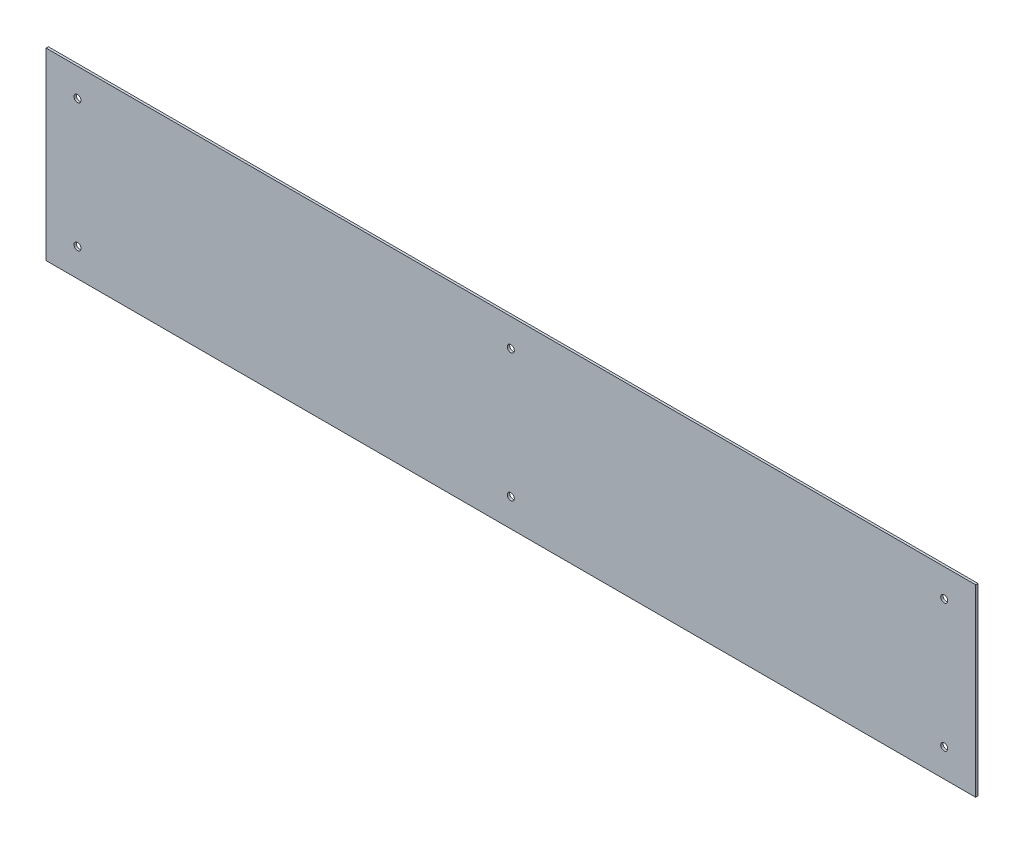
from build123d import *

# Parameters (mm, degrees)
SKETCH1_W           = 798
SKETCH1_H           = 158
SKETCH1_R           = 3
BOSS_EXTRUDE1_DEPTH = 1


with BuildPart() as part:
    # Sketch1 → Boss-Extrude1 (new, symmetric)
    with BuildSketch(Plane.XY):
        Rectangle(SKETCH1_W, SKETCH1_H)
        with Locations((0, 55)):
            Circle(SKETCH1_R, mode=Mode.SUBTRACT)
        with Locations((-372, 55)):
            Circle(SKETCH1_R, mode=Mode.SUBTRACT)
        with Locations((-372, -55)):
            Circle(SKETCH1_R, mode=Mode.SUBTRACT)
        with Locations((0, -55)):
            Circle(SKETCH1_R, mode=Mode.SUBTRACT)
        with Locations((372, -55)):
            Circle(SKETCH1_R, mode=Mode.SUBTRACT)
        with Locations((372, 55)):
            Circle(SKETCH1_R, mode=Mode.SUBTRACT)
    extrude(amount=BOSS_EXTRUDE1_DEPTH, both=True)


solid = part.part
